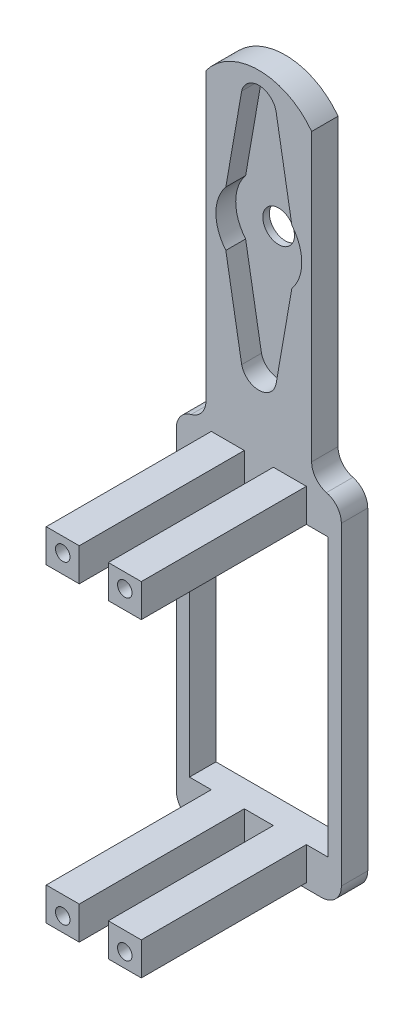
from build123d import *

# Parameters (mm, degrees)
SKETCH_1_R           = 1.4
SKETCH_1_W           = 21
SKETCH_1_H           = 42
EXTRUDE_1_DEPTH      = 4
FILLET_6_R           = 3
FILLET_7_R           = 3
FILLET_8_R           = 3
FILLET_9_R           = 3
FILLET_10_R          = 3
FILLET_11_R          = 3
SKETCH_2_R           = 2.4
EXTRUDE_2_DEPTH      = 1
EXTRUDE_3_DEPTH      = 25
EXTRUDE_3_DEPTH_BACK = 4
SKETCH_3_W           = 5
SKETCH_3_H           = 5
SKETCH_5_2_R         = 1.1
CUT_EXTRUDE_2_DEPTH  = 15


with BuildPart() as part:
    # 草圖1 → 填料-伸長1 (new body)
    with BuildSketch(Plane.XY):
        with BuildLine():
            Line((8, -18.141285654), (8, 17.94275172))
            ThreePointArc((8, 17.94275172), (0, 21.985231559), (-8, 17.94275172))
            Line((-8, 17.94275172), (-8, -18.141285654))
            Line((-8, -18.141285654), (-8, -28.206652459))
            Line((-8, -28.206652459), (-12.5, -28.206652459))
            Line((-12.5, -28.206652459), (-12.5, -81.793347541))
            Line((-12.5, -81.793347541), (12.5, -81.793347541))
            Line((12.5, -81.793347541), (12.5, -28.206652459))
            Line((12.5, -28.206652459), (8, -28.206652459))
            Line((8, -28.206652459), (8, -18.141285654))
        make_face()
        with Locations((-4.7, -78.8)):
            Circle(SKETCH_1_R, mode=Mode.SUBTRACT)
        with Locations((0, -55)):
            Rectangle(SKETCH_1_W, SKETCH_1_H, mode=Mode.SUBTRACT)
        with Locations((-4.7, -31.2)):
            Circle(SKETCH_1_R, mode=Mode.SUBTRACT)
        with Locations((4.7, -78.8)):
            Circle(SKETCH_1_R, mode=Mode.SUBTRACT)
        with Locations((4.7, -31.2)):
            Circle(SKETCH_1_R, mode=Mode.SUBTRACT)
        with BuildLine():
            ThreePointArc((-4.999271035, -4.154189345), (-6.5, 0), (-4.999271035, 4.154189345))
            Line((-4.999271035, 4.154189345), (-2.6, 17.94275172))
            ThreePointArc((-2.6, 17.94275172), (0, 20), (2.6, 17.94275172))
            Line((2.6, 17.94275172), (4.999271035, 4.154189345))
            ThreePointArc((4.999271035, 4.154189345), (6.5, 0), (4.999271035, -4.154189345))
            Line((4.999271035, -4.154189345), (2.6, -17.94275172))
            ThreePointArc((2.6, -17.94275172), (0, -20), (-2.6, -17.94275172))
            Line((-2.6, -17.94275172), (-4.999271035, -4.154189345))
        make_face(mode=Mode.SUBTRACT)
    extrude(amount=EXTRUDE_1_DEPTH)

    # 圓角6
    fillet_6_edges = [part.edges().sort_by_distance(p)[0] for p in [
        (-12.5, -81.793347541, 2),
    ]]
    fillet(fillet_6_edges, radius=FILLET_6_R)

    # 圓角7
    fillet_7_edges = [part.edges().sort_by_distance(p)[0] for p in [
        (12.5, -81.793347541, 2),
    ]]
    fillet(fillet_7_edges, radius=FILLET_7_R)

    # 圓角8
    fillet_8_edges = [part.edges().sort_by_distance(p)[0] for p in [
        (12.5, -28.206652459, 2),
    ]]
    fillet(fillet_8_edges, radius=FILLET_8_R)

    # 圓角9
    fillet_9_edges = [part.edges().sort_by_distance(p)[0] for p in [
        (8, -28.206652459, 2),
    ]]
    fillet(fillet_9_edges, radius=FILLET_9_R)

    # 圓角10
    fillet_10_edges = [part.edges().sort_by_distance(p)[0] for p in [
        (-12.5, -28.206652459, 2),
    ]]
    fillet(fillet_10_edges, radius=FILLET_10_R)

    # 圓角11
    fillet_11_edges = [part.edges().sort_by_distance(p)[0] for p in [
        (-8, -28.206652459, 2),
    ]]
    fillet(fillet_11_edges, radius=FILLET_11_R)

    # 草圖2 → 填料-伸長2 (add)
    with BuildSketch(Plane.XY):
        with BuildLine():
            Line((-3.702325647, 20.172267208), (4.497563026, 20.172267208))
            ThreePointArc((4.497563026, 20.172267208), (6.068658829, 19.068237677), (7.032818959, 17.407629814))
            Line((7.032818959, 17.407629814), (7.032818959, -20.628324178))
            Line((7.032818959, -20.628324178), (-6.646673958, -20.628324178))
            Line((-6.646673958, -20.628324178), (-6.646673958, 17.471058727))
            ThreePointArc((-6.646673958, 17.471058727), (-5.621736824, 19.309156464), (-3.702325647, 20.172267208))
        make_face()
        Circle(SKETCH_2_R, mode=Mode.SUBTRACT)
    extrude(amount=EXTRUDE_2_DEPTH)

    # 草圖3 → 填料-伸長3 (add, two sides: drawn at the far end of the back side and taken through both)
    with BuildSketch(Plane.XY.offset(4).offset(-EXTRUDE_3_DEPTH_BACK)):
        with Locations((-4.7, -31.5)):
            Rectangle(SKETCH_3_W, SKETCH_3_H)
        with Locations((-4.7, -78.5)):
            Rectangle(SKETCH_3_W, SKETCH_3_H)
        with Locations((4.7, -78.5)):
            Rectangle(SKETCH_3_W, SKETCH_3_H)
        with Locations((4.7, -31.5)):
            Rectangle(SKETCH_3_W, SKETCH_3_H)
    extrude(amount=EXTRUDE_3_DEPTH + EXTRUDE_3_DEPTH_BACK)

    # 草圖5<2> → 除料-伸長2 (cut)
    with BuildSketch(Plane.XY.offset(29)):
        with Locations((-4.7, -31.195)):
            Circle(SKETCH_5_2_R)
        with Locations((-4.7, -78.805)):
            Circle(SKETCH_5_2_R)
        with Locations((4.7, -78.805)):
            Circle(SKETCH_5_2_R)
        with Locations((4.7, -31.195)):
            Circle(SKETCH_5_2_R)
    extrude(amount=-CUT_EXTRUDE_2_DEPTH, mode=Mode.SUBTRACT)


solid = part.part
